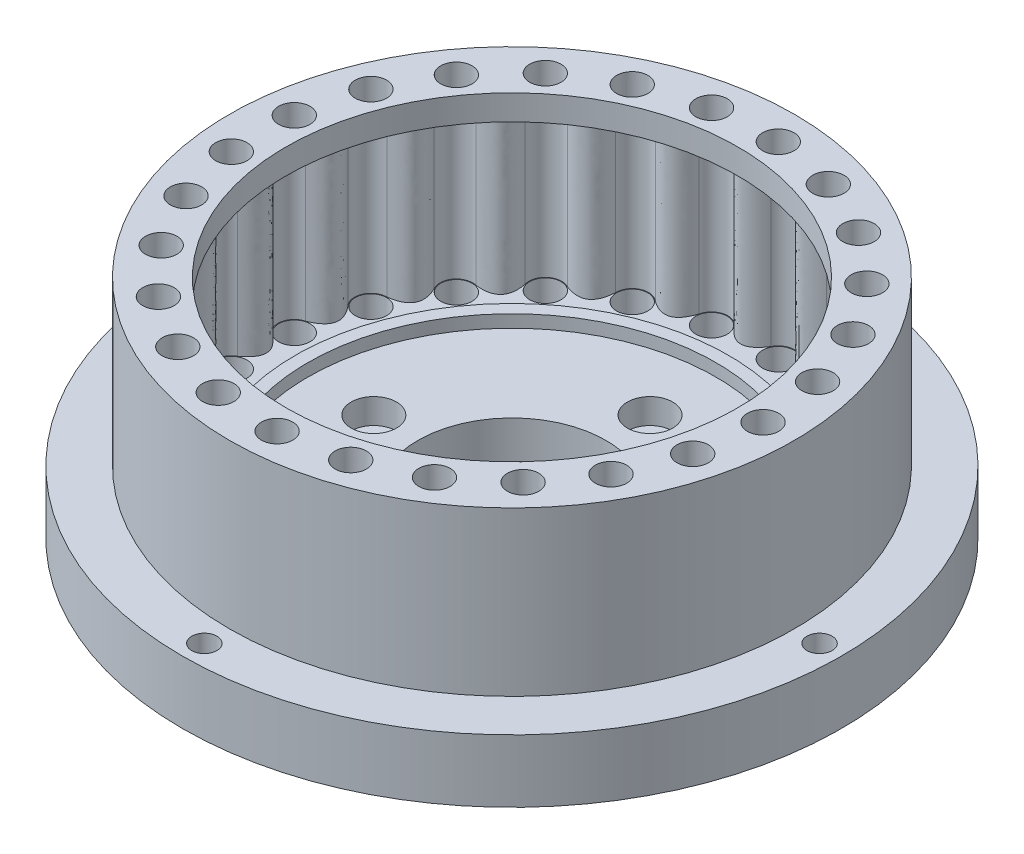
from build123d import *

# Parameters (mm, degrees)
SKETCH1_R           = 45
SKETCH1_R_2         = 2
BOSS_EXTRUDE1_DEPTH = 6
SKETCH2_R           = 3.61
CUT_EXTRUDE1_DEPTH  = 4
SKETCH4_R           = 15
CUT_EXTRUDE2_DEPTH  = 64.921827258
SKETCH5_R           = 2.5
CUT_EXTRUDE3_DEPTH  = 4
SKETCH6_R           = 34.5
SKETCH6_R_2         = 32.5
BOSS_EXTRUDE2_DEPTH = 2
SKETCH7_R           = 45
BOSS_EXTRUDE4_DEPTH = 30
BOSS_EXTRUDE5_START = -4
SKETCH8_R           = 45
SKETCH8_R_2         = 36
BOSS_EXTRUDE5_DEPTH = 4
SKETCH9_R           = 2.5
CUT_EXTRUDE4_DEPTH  = 4
SKETCH10_R          = 52.5
SKETCH10_R_2        = 45
BOSS_EXTRUDE6_DEPTH = 10
SKETCH11_R          = 2
CUT_EXTRUDE5_DEPTH  = 10


with BuildPart() as part:
    # Sketch1 → Boss-Extrude1 (new body)
    with BuildSketch(Plane(origin=(0, 0, 0), x_dir=(1, 0, 0), z_dir=(0, 1, 0))):
        Circle(SKETCH1_R)
        with Locations((0, -22)):
            Circle(SKETCH1_R_2, mode=Mode.SUBTRACT)
        with Locations((-22, 0)):
            Circle(SKETCH1_R_2, mode=Mode.SUBTRACT)
        with Locations((0, 22)):
            Circle(SKETCH1_R_2, mode=Mode.SUBTRACT)
        with Locations((22, 0)):
            Circle(SKETCH1_R_2, mode=Mode.SUBTRACT)
    extrude(amount=BOSS_EXTRUDE1_DEPTH)

    # Sketch2 → Cut-Extrude1 (cut)
    with BuildSketch(Plane(origin=(0, 6, 0), x_dir=(1, 0, 0), z_dir=(0, 1, 0))):
        with Locations((0, 22)):
            Circle(SKETCH2_R)
        with Locations((22, 0)):
            Circle(SKETCH2_R)
        with Locations((0, -22)):
            Circle(SKETCH2_R)
        with Locations((-22, 0)):
            Circle(SKETCH2_R)
    extrude(amount=-CUT_EXTRUDE1_DEPTH, mode=Mode.SUBTRACT)

    # Sketch4 → Cut-Extrude2 (cut, through all)
    with BuildSketch(Plane(origin=(0, 6, 0), x_dir=(1, 0, 0), z_dir=(0, 1, 0))):
        Circle(SKETCH4_R)
    extrude(amount=-CUT_EXTRUDE2_DEPTH, mode=Mode.SUBTRACT)

    # Sketch5 → Cut-Extrude3 (cut)
    with BuildSketch(Plane(origin=(0, 6, 0), x_dir=(1, 0, 0), z_dir=(0, 1, 0))):
        with Locations((40, 0)):
            Circle(SKETCH5_R)
        with Locations((38.743326445, -9.947595487)):
            Circle(SKETCH5_R)
        with Locations((35.052267202, -19.270146964)):
            Circle(SKETCH5_R)
        with Locations((29.158745097, -27.381884237)):
            Circle(SKETCH5_R)
        with Locations((21.433071799, -33.77311702)):
            Circle(SKETCH5_R)
        with Locations((12.360679775, -38.042260652)):
            Circle(SKETCH5_R)
        with Locations((2.511620781, -39.921069137)):
            Circle(SKETCH5_R)
        with Locations((-7.495252583, -39.291490029)):
            Circle(SKETCH5_R)
        with Locations((-17.031171663, -36.193082099)):
            Circle(SKETCH5_R)
        with Locations((-25.49695959, -30.820529711)):
            Circle(SKETCH5_R)
        with Locations((-32.360679775, -23.511410092)):
            Circle(SKETCH5_R)
        with Locations((-37.191059436, -14.724982107)):
            Circle(SKETCH5_R)
        with Locations((-39.684588053, -5.013329343)):
            Circle(SKETCH5_R)
        with Locations((-39.684588053, 5.013329343)):
            Circle(SKETCH5_R)
        with Locations((-37.191059436, 14.724982107)):
            Circle(SKETCH5_R)
        with Locations((-32.360679775, 23.511410092)):
            Circle(SKETCH5_R)
        with Locations((-25.49695959, 30.820529711)):
            Circle(SKETCH5_R)
        with Locations((-17.031171663, 36.193082099)):
            Circle(SKETCH5_R)
        with Locations((-7.495252583, 39.291490029)):
            Circle(SKETCH5_R)
        with Locations((2.511620781, 39.921069137)):
            Circle(SKETCH5_R)
        with Locations((12.360679775, 38.042260652)):
            Circle(SKETCH5_R)
        with Locations((21.433071799, 33.77311702)):
            Circle(SKETCH5_R)
        with Locations((29.158745097, 27.381884237)):
            Circle(SKETCH5_R)
        with Locations((35.052267202, 19.270146964)):
            Circle(SKETCH5_R)
        with Locations((38.743326445, 9.947595487)):
            Circle(SKETCH5_R)
    extrude(amount=-CUT_EXTRUDE3_DEPTH, mode=Mode.SUBTRACT)

    # Sketch6 → Boss-Extrude2 (add)
    with BuildSketch(Plane(origin=(0, 6, 0), x_dir=(1, 0, 0), z_dir=(0, 1, 0))):
        Circle(SKETCH6_R)
        Circle(SKETCH6_R_2, mode=Mode.SUBTRACT)
    extrude(amount=BOSS_EXTRUDE2_DEPTH)

    # Sketch7 → Boss-Extrude4 (add)
    with BuildSketch(Plane(origin=(0, 6, 0), x_dir=(1, 0, 0), z_dir=(0, 1, 0))):
        Circle(SKETCH7_R)
        with BuildLine():
            ThreePointArc((34.786085666, -21.856485571), (37.33066457, -20.522706517), (37.093357913, -17.659572934))
            add(Edge.make_bspline(
                [(37.093357913, -17.659572934), (36.992833187, -17.498762481), (36.795597124, -17.160956609), (36.491730857, -16.541708189), (36.246669275, -15.818483644), (36.175890696, -15.051815417), (36.318726706, -14.379601147), (36.674766069, -13.791800055), (37.251181949, -13.281374242), (37.924905423, -12.921922435), (38.570319112, -12.678520537), (38.945342047, -12.567288031), (39.128703748, -12.518876166)],
                knots=[0.000576873, 0.000576873, 0.000576873, 0.000576873, 0.063004764, 0.125432655, 0.250288437, 0.375144218, 0.5, 0.624855782, 0.749711563, 0.874567345, 0.936995236, 0.999423127, 0.999423127, 0.999423127, 0.999423127], degree=3))
            ThreePointArc((39.128703748, -12.518876166), (41.261642664, -10.594189193), (40.319759065, -7.880021982))
            add(Edge.make_bspline(
                [(40.319759065, -7.880021982), (40.182400575, -7.749263168), (39.907352141, -7.471120704), (39.459031572, -6.946895579), (39.041810419, -6.3073368), (38.782592844, -5.582356783), (38.753768508, -4.895739488), (38.952442052, -4.237861859), (39.383811029, -3.600123211), (39.946976213, -3.084416029), (40.511581453, -2.688153193), (40.847159953, -2.487150849), (41.012721469, -2.394659731)],
                knots=[0.000576873, 0.000576873, 0.000576873, 0.000576873, 0.063004764, 0.125432655, 0.250288437, 0.375144218, 0.5, 0.624855782, 0.749711563, 0.874567345, 0.936995236, 0.999423127, 0.999423127, 0.999423127, 0.999423127], degree=3))
            ThreePointArc((41.012721469, -2.394659731), (42.6, 0), (41.012721469, 2.394659731))
            add(Edge.make_bspline(
                [(41.012721469, 2.394659731), (40.847159953, 2.487150849), (40.511581453, 2.688153193), (39.946976213, 3.084416029), (39.383811029, 3.600123211), (38.952442052, 4.237861859), (38.753768508, 4.895739488), (38.782592844, 5.582356783), (39.041810419, 6.3073368), (39.459031572, 6.946895579), (39.907352141, 7.471120704), (40.182400575, 7.749263168), (40.319759065, 7.880021982)],
                knots=[0.000576873, 0.000576873, 0.000576873, 0.000576873, 0.063004764, 0.125432655, 0.250288437, 0.375144218, 0.5, 0.624855782, 0.749711563, 0.874567345, 0.936995236, 0.999423127, 0.999423127, 0.999423127, 0.999423127], degree=3))
            ThreePointArc((40.319759065, 7.880021982), (41.261642664, 10.594189193), (39.128703748, 12.518876166))
            add(Edge.make_bspline(
                [(39.128703748, 12.518876166), (38.945342047, 12.567288031), (38.570319112, 12.678520537), (37.924905423, 12.921922435), (37.251181949, 13.281374242), (36.674766069, 13.791800055), (36.318726706, 14.379601147), (36.175890696, 15.051815417), (36.246669275, 15.818483644), (36.491730857, 16.541708189), (36.795597124, 17.160956609), (36.992833187, 17.498762481), (37.093357913, 17.659572934)],
                knots=[0.000576873, 0.000576873, 0.000576873, 0.000576873, 0.063004764, 0.125432655, 0.250288437, 0.375144218, 0.5, 0.624855782, 0.749711563, 0.874567345, 0.936995236, 0.999423127, 0.999423127, 0.999423127, 0.999423127], degree=3))
            ThreePointArc((37.093357913, 17.659572934), (37.33066457, 20.522706517), (34.786085666, 21.856485571))
            add(Edge.make_bspline(
                [(34.786085666, 21.856485571), (34.596445068, 21.857776287), (34.20554177, 21.872249808), (33.519873348, 21.94749693), (32.777924106, 22.128107683), (32.092679653, 22.479148731), (31.601645735, 22.959939581), (31.296124289, 23.575513133), (31.174016594, 24.335696984), (31.231520486, 25.097144438), (31.371839415, 25.772506497), (31.478870041, 26.148750191), (31.536244664, 26.32950797)],
                knots=[0.000576873, 0.000576873, 0.000576873, 0.000576873, 0.063004764, 0.125432655, 0.250288437, 0.375144218, 0.5, 0.624855782, 0.749711563, 0.874567345, 0.936995236, 0.999423127, 0.999423127, 0.999423127, 0.999423127], degree=3))
            ThreePointArc((31.536244664, 26.32950797), (31.054063528, 29.161706713), (28.257729887, 29.820771605))
            add(Edge.make_bspline(
                [(28.257729887, 29.820771605), (28.07372621, 29.774860072), (27.691504438, 29.691665184), (27.008664353, 29.594029476), (26.245108743, 29.584450736), (25.494092146, 29.754049819), (24.898917139, 30.097620571), (24.449907294, 30.617874654), (24.1425858, 31.323808983), (24.00891882, 32.0756348), (23.976873658, 32.764675018), (23.986973718, 33.155715758), (23.997593181, 33.345063188)],
                knots=[0.000576873, 0.000576873, 0.000576873, 0.000576873, 0.063004764, 0.125432655, 0.250288437, 0.375144218, 0.5, 0.624855782, 0.749711563, 0.874567345, 0.936995236, 0.999423127, 0.999423127, 0.999423127, 0.999423127], degree=3))
            ThreePointArc((23.997593181, 33.345063188), (22.826221466, 35.968369626), (19.953837015, 35.911308886))
            add(Edge.make_bspline(
                [(19.953837015, 35.911308886), (19.787031885, 35.821079894), (19.437508041, 35.645444037), (18.800401646, 35.381060311), (18.063216675, 35.181893946), (17.293617069, 35.159394529), (16.631698007, 35.344157369), (16.067412703, 35.736402505), (15.594187551, 36.343730862), (15.277748487, 37.038695063), (15.075352749, 37.698118507), (14.987887619, 38.079385766), (14.951084661, 38.265425451)],
                knots=[0.000576873, 0.000576873, 0.000576873, 0.000576873, 0.063004764, 0.125432655, 0.250288437, 0.375144218, 0.5, 0.624855782, 0.749711563, 0.874567345, 0.936995236, 0.999423127, 0.999423127, 0.999423127, 0.999423127], degree=3))
            ThreePointArc((14.951084661, 38.265425451), (13.16412396, 40.515007594), (10.396171178, 39.745406556))
            add(Edge.make_bspline(
                [(10.396171178, 39.745406556), (10.257045576, 39.616529525), (9.962181528, 39.359488547), (9.41084056, 38.944969004), (8.746346272, 38.56872937), (8.00652043, 38.355545174), (7.319448123, 38.369890772), (6.675343481, 38.609480758), (6.065949146, 39.080042468), (5.586621029, 39.674477895), (5.226591983, 40.262850566), (5.047057419, 40.61038792), (4.965144505, 40.781430303)],
                knots=[0.000576873, 0.000576873, 0.000576873, 0.000576873, 0.063004764, 0.125432655, 0.250288437, 0.375144218, 0.5, 0.624855782, 0.749711563, 0.874567345, 0.936995236, 0.999423127, 0.999423127, 0.999423127, 0.999423127], degree=3))
            ThreePointArc((4.965144505, 40.781430303), (2.674876132, 42.515938631), (0.185275671, 41.08215416))
            add(Edge.make_bspline(
                [(0.185275671, 41.08215416), (0.08257137, 40.922726908), (-0.13910549, 40.600431637), (-0.570038249, 40.061822065), (-1.120089235, 39.532149681), (-1.783655334, 39.141675854), (-2.452709606, 38.984702824), (-3.136162123, 39.056583339), (-3.843435152, 39.360811279), (-4.455534375, 39.817367369), (-4.95057478, 40.297719647), (-5.21089796, 40.589690046), (-5.33277394, 40.734987905)],
                knots=[0.000576873, 0.000576873, 0.000576873, 0.000576873, 0.063004764, 0.125432655, 0.250288437, 0.375144218, 0.5, 0.624855782, 0.749711563, 0.874567345, 0.936995236, 0.999423127, 0.999423127, 0.999423127, 0.999423127], degree=3))
            ThreePointArc((-5.33277394, 40.734987905), (-7.982444001, 41.845436881), (-10.037261387, 39.837558928))
            add(Edge.make_bspline(
                [(-10.037261387, 39.837558928), (-10.097091098, 39.657598855), (-10.231651998, 39.290300289), (-10.515099458, 38.661443509), (-10.916145416, 38.011619639), (-11.461757473, 37.468391087), (-12.07075457, 37.149962622), (-12.750611127, 37.049617149), (-13.511322285, 37.168395559), (-14.217732168, 37.458385213), (-14.816678722, 37.800534799), (-15.141433456, 38.018592668), (-15.295614586, 38.129016404)],
                knots=[0.000576873, 0.000576873, 0.000576873, 0.000576873, 0.063004764, 0.125432655, 0.250288437, 0.375144218, 0.5, 0.624855782, 0.749711563, 0.874567345, 0.936995236, 0.999423127, 0.999423127, 0.999423127, 0.999423127], degree=3))
            ThreePointArc((-15.295614586, 38.129016404), (-18.138197821, 38.545632435), (-19.629120398, 36.089823356))
            add(Edge.make_bspline(
                [(-19.629120398, 36.089823356), (-19.642316199, 35.900638016), (-19.681306181, 35.511414875), (-19.799458296, 34.83182427), (-20.026300033, 34.102679738), (-20.419675237, 33.440829508), (-20.930349631, 32.98095364), (-21.56389234, 32.714687254), (-22.330243348, 32.64055285), (-23.086577559, 32.745754952), (-23.751796248, 32.928203329), (-24.120577002, 33.058647291), (-24.297375514, 33.127258574)],
                knots=[0.000576873, 0.000576873, 0.000576873, 0.000576873, 0.063004764, 0.125432655, 0.250288437, 0.375144218, 0.5, 0.624855782, 0.749711563, 0.874567345, 0.936995236, 0.999423127, 0.999423127, 0.999423127, 0.999423127], degree=3))
            ThreePointArc((-24.297375514, 33.127258574), (-27.154261963, 32.823864142), (-27.987609584, 30.074431454))
            add(Edge.make_bspline(
                [(-27.987609584, 30.074431454), (-27.953342333, 29.887908057), (-27.894311514, 29.501216663), (-27.839744353, 28.813593409), (-27.878128568, 28.050943048), (-28.094549707, 27.312057625), (-28.474813849, 26.739630046), (-29.022234891, 26.324173243), (-29.746073096, 26.061784162), (-30.504808376, 25.975588477), (-31.194501062, 25.986871742), (-31.584135985, 26.021505523), (-31.77244298, 26.043993254)],
                knots=[0.000576873, 0.000576873, 0.000576873, 0.000576873, 0.063004764, 0.125432655, 0.250288437, 0.375144218, 0.5, 0.624855782, 0.749711563, 0.874567345, 0.936995236, 0.999423127, 0.999423127, 0.999423127, 0.999423127], degree=3))
            ThreePointArc((-31.77244298, 26.043993254), (-34.46412396, 25.039651748), (-34.587534328, 22.169352418))
            add(Edge.make_bspline(
                [(-34.587534328, 22.169352418), (-34.507957163, 21.997210914), (-34.354614667, 21.637348509), (-34.130756884, 20.984898506), (-33.978271756, 20.236662442), (-34.004140295, 19.467168715), (-34.230100789, 18.818157154), (-34.657003687, 18.279614614), (-35.292847673, 17.845457726), (-36.006309894, 17.573280246), (-36.67714065, 17.41268943), (-37.063147546, 17.349336862), (-37.251131002, 17.324288055)],
                knots=[0.000576873, 0.000576873, 0.000576873, 0.000576873, 0.063004764, 0.125432655, 0.250288437, 0.375144218, 0.5, 0.624855782, 0.749711563, 0.874567345, 0.936995236, 0.999423127, 0.999423127, 0.999423127, 0.999423127], degree=3))
            ThreePointArc((-37.251131002, 17.324288055), (-39.608478299, 15.682105944), (-39.014197086, 12.871291436))
            add(Edge.make_bspline(
                [(-39.014197086, 12.871291436), (-38.894310133, 12.72434811), (-38.656291033, 12.413926172), (-38.277208436, 11.837645253), (-37.943435166, 11.15083791), (-37.77712569, 10.399085999), (-37.834584607, 9.71427024), (-38.114145482, 9.086480571), (-38.622042832, 8.507835551), (-39.245402539, 8.066778187), (-39.855220601, 7.744403802), (-40.213345238, 7.58704556), (-40.389193463, 7.516034123)],
                knots=[0.000576873, 0.000576873, 0.000576873, 0.000576873, 0.063004764, 0.125432655, 0.250288437, 0.375144218, 0.5, 0.624855782, 0.749711563, 0.874567345, 0.936995236, 0.999423127, 0.999423127, 0.999423127, 0.999423127], degree=3))
            ThreePointArc((-40.389193463, 7.516034123), (-42.264086276, 5.33919575), (-40.989454357, 2.764479875))
            add(Edge.make_bspline(
                [(-40.989454357, 2.764479875), (-40.836790555, 2.651967717), (-40.529050465, 2.410491199), (-40.018562208, 1.946589212), (-39.524472999, 1.364365222), (-39.176435343, 0.677590465), (-39.061782329, 0), (-39.176435343, -0.677590465), (-39.524472999, -1.364365222), (-40.018562208, -1.946589212), (-40.529050465, -2.410491199), (-40.836790555, -2.651967717), (-40.989454357, -2.764479875)],
                knots=[0.000576873, 0.000576873, 0.000576873, 0.000576873, 0.063004764, 0.125432655, 0.250288437, 0.375144218, 0.5, 0.624855782, 0.749711563, 0.874567345, 0.936995236, 0.999423127, 0.999423127, 0.999423127, 0.999423127], degree=3))
            ThreePointArc((-40.989454357, -2.764479875), (-42.264086276, -5.33919575), (-40.389193463, -7.516034123))
            add(Edge.make_bspline(
                [(-40.389193463, -7.516034123), (-40.213345238, -7.58704556), (-39.855220601, -7.744403802), (-39.245402539, -8.066778187), (-38.622042832, -8.507835551), (-38.114145482, -9.086480571), (-37.834584607, -9.71427024), (-37.77712569, -10.399085999), (-37.943435166, -11.15083791), (-38.277208436, -11.837645253), (-38.656291033, -12.413926172), (-38.894310133, -12.72434811), (-39.014197086, -12.871291436)],
                knots=[0.000576873, 0.000576873, 0.000576873, 0.000576873, 0.063004764, 0.125432655, 0.250288437, 0.375144218, 0.5, 0.624855782, 0.749711563, 0.874567345, 0.936995236, 0.999423127, 0.999423127, 0.999423127, 0.999423127], degree=3))
            ThreePointArc((-39.014197086, -12.871291436), (-39.608478299, -15.682105944), (-37.251131002, -17.324288055))
            add(Edge.make_bspline(
                [(-37.251131002, -17.324288055), (-37.063147546, -17.349336862), (-36.67714065, -17.41268943), (-36.006309894, -17.573280246), (-35.292847673, -17.845457726), (-34.657003687, -18.279614614), (-34.230100789, -18.818157154), (-34.004140295, -19.467168715), (-33.978271756, -20.236662442), (-34.130756884, -20.984898506), (-34.354614667, -21.637348509), (-34.507957163, -21.997210914), (-34.587534328, -22.169352418)],
                knots=[0.000576873, 0.000576873, 0.000576873, 0.000576873, 0.063004764, 0.125432655, 0.250288437, 0.375144218, 0.5, 0.624855782, 0.749711563, 0.874567345, 0.936995236, 0.999423127, 0.999423127, 0.999423127, 0.999423127], degree=3))
            ThreePointArc((-34.587534328, -22.169352418), (-34.46412396, -25.039651748), (-31.77244298, -26.043993254))
            add(Edge.make_bspline(
                [(-31.77244298, -26.043993254), (-31.584135985, -26.021505523), (-31.194501062, -25.986871742), (-30.504808376, -25.975588477), (-29.746073096, -26.061784162), (-29.022234891, -26.324173243), (-28.474813849, -26.739630046), (-28.094549707, -27.312057625), (-27.878128568, -28.050943048), (-27.839744353, -28.813593409), (-27.894311514, -29.501216663), (-27.953342333, -29.887908057), (-27.987609584, -30.074431454)],
                knots=[0.000576873, 0.000576873, 0.000576873, 0.000576873, 0.063004764, 0.125432655, 0.250288437, 0.375144218, 0.5, 0.624855782, 0.749711563, 0.874567345, 0.936995236, 0.999423127, 0.999423127, 0.999423127, 0.999423127], degree=3))
            ThreePointArc((-27.987609584, -30.074431454), (-27.154261963, -32.823864142), (-24.297375514, -33.127258574))
            add(Edge.make_bspline(
                [(-24.297375514, -33.127258574), (-24.120577002, -33.058647291), (-23.751796248, -32.928203329), (-23.086577559, -32.745754952), (-22.330243348, -32.64055285), (-21.56389234, -32.714687254), (-20.930349631, -32.98095364), (-20.419675237, -33.440829508), (-20.026300033, -34.102679738), (-19.799458296, -34.83182427), (-19.681306181, -35.511414875), (-19.642316199, -35.900638016), (-19.629120398, -36.089823356)],
                knots=[0.000576873, 0.000576873, 0.000576873, 0.000576873, 0.063004764, 0.125432655, 0.250288437, 0.375144218, 0.5, 0.624855782, 0.749711563, 0.874567345, 0.936995236, 0.999423127, 0.999423127, 0.999423127, 0.999423127], degree=3))
            ThreePointArc((-19.629120398, -36.089823356), (-18.138197821, -38.545632435), (-15.295614586, -38.129016404))
            add(Edge.make_bspline(
                [(-15.295614586, -38.129016404), (-15.141433456, -38.018592668), (-14.816678722, -37.800534799), (-14.217732168, -37.458385213), (-13.511322285, -37.168395559), (-12.750611127, -37.049617149), (-12.07075457, -37.149962622), (-11.461757473, -37.468391087), (-10.916145416, -38.011619639), (-10.515099458, -38.661443509), (-10.231651998, -39.290300289), (-10.097091098, -39.657598855), (-10.037261387, -39.837558928)],
                knots=[0.000576873, 0.000576873, 0.000576873, 0.000576873, 0.063004764, 0.125432655, 0.250288437, 0.375144218, 0.5, 0.624855782, 0.749711563, 0.874567345, 0.936995236, 0.999423127, 0.999423127, 0.999423127, 0.999423127], degree=3))
            ThreePointArc((-10.037261387, -39.837558928), (-7.982444001, -41.845436881), (-5.33277394, -40.734987905))
            add(Edge.make_bspline(
                [(-5.33277394, -40.734987905), (-5.21089796, -40.589690046), (-4.95057478, -40.297719647), (-4.455534375, -39.817367369), (-3.843435152, -39.360811279), (-3.136162123, -39.056583339), (-2.452709606, -38.984702824), (-1.783655334, -39.141675854), (-1.120089235, -39.532149681), (-0.570038249, -40.061822065), (-0.13910549, -40.600431637), (0.08257137, -40.922726908), (0.185275671, -41.08215416)],
                knots=[0.000576873, 0.000576873, 0.000576873, 0.000576873, 0.063004764, 0.125432655, 0.250288437, 0.375144218, 0.5, 0.624855782, 0.749711563, 0.874567345, 0.936995236, 0.999423127, 0.999423127, 0.999423127, 0.999423127], degree=3))
            ThreePointArc((0.185275671, -41.08215416), (2.674876132, -42.515938631), (4.965144505, -40.781430303))
            add(Edge.make_bspline(
                [(4.965144505, -40.781430303), (5.047057419, -40.61038792), (5.226591983, -40.262850566), (5.586621029, -39.674477895), (6.065949146, -39.080042468), (6.675343481, -38.609480758), (7.319448123, -38.369890772), (8.00652043, -38.355545174), (8.746346272, -38.56872937), (9.41084056, -38.944969004), (9.962181528, -39.359488547), (10.257045576, -39.616529525), (10.396171178, -39.745406556)],
                knots=[0.000576873, 0.000576873, 0.000576873, 0.000576873, 0.063004764, 0.125432655, 0.250288437, 0.375144218, 0.5, 0.624855782, 0.749711563, 0.874567345, 0.936995236, 0.999423127, 0.999423127, 0.999423127, 0.999423127], degree=3))
            ThreePointArc((10.396171178, -39.745406556), (13.16412396, -40.515007594), (14.951084661, -38.265425451))
            add(Edge.make_bspline(
                [(14.951084661, -38.265425451), (14.987887619, -38.079385766), (15.075352749, -37.698118507), (15.277748487, -37.038695063), (15.594187551, -36.343730862), (16.067412703, -35.736402505), (16.631698007, -35.344157369), (17.293617069, -35.159394529), (18.063216675, -35.181893946), (18.800401646, -35.381060311), (19.437508041, -35.645444037), (19.787031885, -35.821079894), (19.953837015, -35.911308886)],
                knots=[0.000576873, 0.000576873, 0.000576873, 0.000576873, 0.063004764, 0.125432655, 0.250288437, 0.375144218, 0.5, 0.624855782, 0.749711563, 0.874567345, 0.936995236, 0.999423127, 0.999423127, 0.999423127, 0.999423127], degree=3))
            ThreePointArc((19.953837015, -35.911308886), (22.826221466, -35.968369626), (23.997593181, -33.345063188))
            add(Edge.make_bspline(
                [(23.997593181, -33.345063188), (23.986973718, -33.155715758), (23.976873658, -32.764675018), (24.00891882, -32.0756348), (24.1425858, -31.323808983), (24.449907294, -30.617874654), (24.898917139, -30.097620571), (25.494092146, -29.754049819), (26.245108743, -29.584450736), (27.008664353, -29.594029476), (27.691504438, -29.691665184), (28.07372621, -29.774860072), (28.257729887, -29.820771605)],
                knots=[0.000576873, 0.000576873, 0.000576873, 0.000576873, 0.063004764, 0.125432655, 0.250288437, 0.375144218, 0.5, 0.624855782, 0.749711563, 0.874567345, 0.936995236, 0.999423127, 0.999423127, 0.999423127, 0.999423127], degree=3))
            ThreePointArc((28.257729887, -29.820771605), (31.054063528, -29.161706713), (31.536244664, -26.32950797))
            add(Edge.make_bspline(
                [(31.536244664, -26.32950797), (31.478870041, -26.148750191), (31.371839415, -25.772506497), (31.231520486, -25.097144438), (31.174016594, -24.335696984), (31.296124289, -23.575513133), (31.601645735, -22.959939581), (32.092679653, -22.479148731), (32.777924106, -22.128107683), (33.519873348, -21.94749693), (34.20554177, -21.872249808), (34.596445068, -21.857776287), (34.786085666, -21.856485571)],
                knots=[0.000576873, 0.000576873, 0.000576873, 0.000576873, 0.063004764, 0.125432655, 0.250288437, 0.375144218, 0.5, 0.624855782, 0.749711563, 0.874567345, 0.936995236, 0.999423127, 0.999423127, 0.999423127, 0.999423127], degree=3))
        make_face(mode=Mode.SUBTRACT)
    extrude(amount=BOSS_EXTRUDE4_DEPTH)

    # Sketch8 → Boss-Extrude5 (add)
    with BuildSketch(Plane(origin=(0, 36, 0), x_dir=(1, 0, 0), z_dir=(0, 1, 0)).offset(BOSS_EXTRUDE5_START)):
        Circle(SKETCH8_R)
        Circle(SKETCH8_R_2, mode=Mode.SUBTRACT)
    extrude(amount=BOSS_EXTRUDE5_DEPTH)

    # Sketch9 → Cut-Extrude4 (cut)
    with BuildSketch(Plane(origin=(0, 36, 0), x_dir=(1, 0, 0), z_dir=(0, 1, 0))):
        with Locations((-17.031171663, 36.193082099)):
            Circle(SKETCH9_R)
        with Locations((-7.495252583, 39.291490029)):
            Circle(SKETCH9_R)
        with Locations((12.360679775, 38.042260652)):
            Circle(SKETCH9_R)
        with Locations((21.433071799, 33.77311702)):
            Circle(SKETCH9_R)
        with Locations((29.158745097, 27.381884237)):
            Circle(SKETCH9_R)
        with Locations((35.052267202, 19.270146964)):
            Circle(SKETCH9_R)
        with Locations((38.743326445, 9.947595487)):
            Circle(SKETCH9_R)
        with Locations((40, 0)):
            Circle(SKETCH9_R)
        with Locations((38.743326445, -9.947595487)):
            Circle(SKETCH9_R)
        with Locations((35.052267202, -19.270146964)):
            Circle(SKETCH9_R)
        with Locations((29.158745097, -27.381884237)):
            Circle(SKETCH9_R)
        with Locations((-7.495252583, -39.291490029)):
            Circle(SKETCH9_R)
        with Locations((12.360679775, -38.042260652)):
            Circle(SKETCH9_R)
        with Locations((2.511620781, 39.921069137)):
            Circle(SKETCH9_R)
        with Locations((-25.49695959, 30.820529711)):
            Circle(SKETCH9_R)
        with Locations((-32.360679775, 23.511410092)):
            Circle(SKETCH9_R)
        with Locations((-37.191059436, 14.724982107)):
            Circle(SKETCH9_R)
        with Locations((-39.684588053, 5.013329343)):
            Circle(SKETCH9_R)
        with Locations((-39.684588053, -5.013329343)):
            Circle(SKETCH9_R)
        with Locations((-37.191059436, -14.724982107)):
            Circle(SKETCH9_R)
        with Locations((-32.360679775, -23.511410092)):
            Circle(SKETCH9_R)
        with Locations((-25.49695959, -30.820529711)):
            Circle(SKETCH9_R)
        with Locations((-17.031171663, -36.193082099)):
            Circle(SKETCH9_R)
        with Locations((2.511620781, -39.921069137)):
            Circle(SKETCH9_R)
        with Locations((21.433071799, -33.77311702)):
            Circle(SKETCH9_R)
    extrude(amount=-CUT_EXTRUDE4_DEPTH, mode=Mode.SUBTRACT)

    # Sketch10 → Boss-Extrude6 (add)
    with BuildSketch(Plane(origin=(0, 0, 0), x_dir=(1, 0, 0), z_dir=(0, 1, 0))):
        Circle(SKETCH10_R)
        Circle(SKETCH10_R_2, mode=Mode.SUBTRACT)
    extrude(amount=BOSS_EXTRUDE6_DEPTH)

    # Sketch11 → Cut-Extrude5 (cut)
    with BuildSketch(Plane(origin=(0, 10, 0), x_dir=(1, 0, 0), z_dir=(0, 1, 0))):
        with Locations((-49, 0)):
            Circle(SKETCH11_R)
        with Locations((0, 49)):
            Circle(SKETCH11_R)
        with Locations((49, 0)):
            Circle(SKETCH11_R)
        with Locations((0, -49)):
            Circle(SKETCH11_R)
    extrude(amount=-CUT_EXTRUDE5_DEPTH, mode=Mode.SUBTRACT)


solid = part.part
